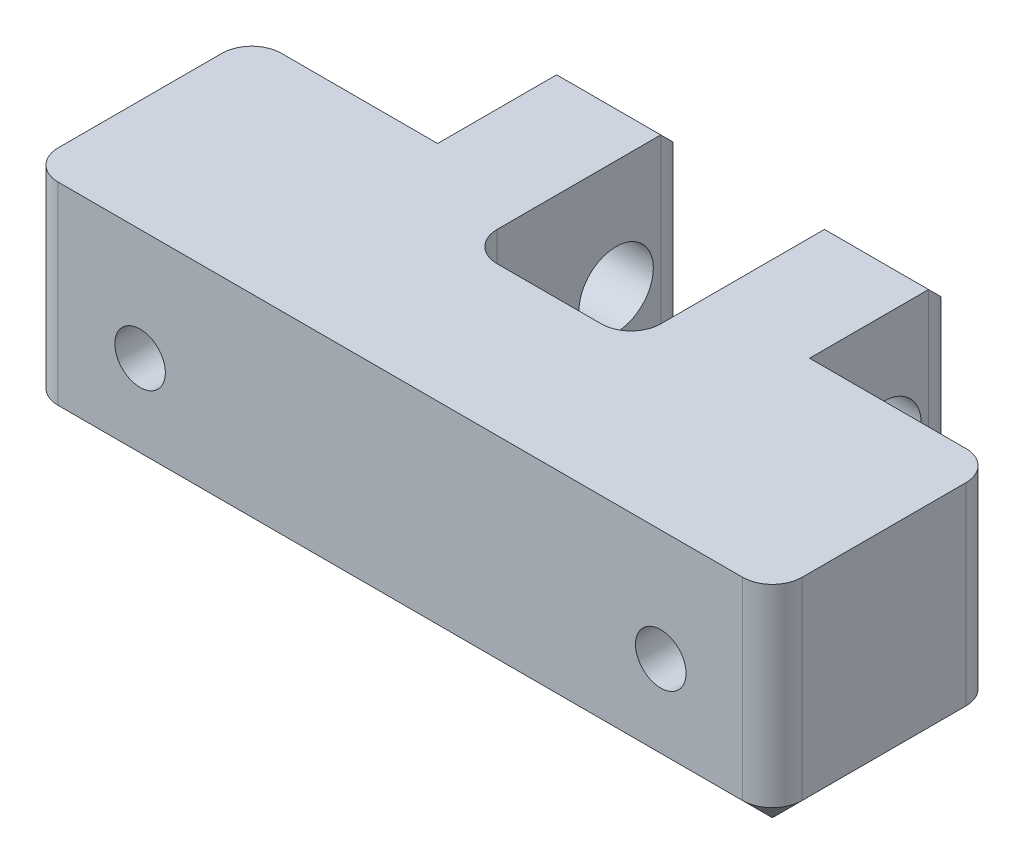
from build123d import *

# Parameters (mm, degrees)
MAIN_BLOCK_DEPTH                = 15
TENSION_SCREW_HOLES_D           = 3.4
TENSION_SCREW_HOLES_CBORE_D     = 6.5
TENSION_SCREW_HOLES_CBORE_DEPTH = 3.4
IDLER_MOUNTING_HOLE_D           = 5
COSMETIC_CHAMFER_SIZE           = 2
PRINT_HELPER_FILLETS_R          = 2
COSMETIC_CHAMFERS_SIZE          = 2


with BuildPart() as part:
    # Main Body Sketch → Main Block (new body)
    with BuildSketch(Plane(origin=(0, 0, 0), x_dir=(1, 0, 0), z_dir=(0, 1, 0))):
        Polygon((-12.5, 20), (-12.5, 10), (-25, 10), (-25, 0), (-25, -5), (25, -5), (25, 10), (12.5, 10), (12.5, 20), (5.5, 20), (5.5, 5), (-5.5, 5), (-5.5, 20), align=None)
    extrude(amount=MAIN_BLOCK_DEPTH)

    # Tension Screw Holes (through all)
    with Locations(Plane(origin=(0, 0, -10), x_dir=(-1, 0, 0), z_dir=(0, 0, -1))):
        with Locations((17.5, 7.5), (-17.5, 7.5)):
            CounterBoreHole(TENSION_SCREW_HOLES_D / 2, TENSION_SCREW_HOLES_CBORE_D / 2, TENSION_SCREW_HOLES_CBORE_DEPTH)

    # Idler Mounting Hole (through all)
    with Locations(Plane(origin=(12.5, 0, 0), x_dir=(0, 0, -1), z_dir=(1, 0, 0))):
        with Locations((15, 7.5)):
            Hole(IDLER_MOUNTING_HOLE_D / 2)

    # Cosmetic Chamfer
    cosmetic_chamfer_edges = [part.edges().sort_by_distance(p)[0] for p in [
        (9, 0, -20),
        (-9, 0, -20),
        (9, 15, -20),
        (-9, 15, -20),
    ]]
    chamfer(cosmetic_chamfer_edges, length=COSMETIC_CHAMFER_SIZE)

    # Print Helper Fillets
    print_helper_fillets_edges = [part.edges().sort_by_distance(p)[0] for p in [
        (-5.5, 7.5, -5),
        (5.5, 7.5, -5),
        (-12.5, 7.5, -20),
        (-5.5, 7.5, -20),
        (5.5, 7.5, -20),
        (12.5, 7.5, -20),
        (-25, 7.5, 5),
        (25, 7.5, -10),
        (25, 7.5, 5),
        (-25, 7.5, -10),
    ]]
    fillet(print_helper_fillets_edges, radius=PRINT_HELPER_FILLETS_R)

    # Cosmetic Chamfers
    cosmetic_chamfers_edges = [part.edges().sort_by_distance(p)[0] for p in [
        (-17.75, 0, -10),
        (-24.414213562, 0, -9.414213562),
        (-25, 0, -2.5),
        (-24.414213562, 0, 4.414213562),
        (0, 0, 5),
        (17.75, 0, -10),
        (24.414213562, 0, 4.414213562),
        (24.414213562, 0, -9.414213562),
        (25, 0, -2.5),
        (-12.5, 0, -14),
        (12.5, 0, -14),
    ]]
    chamfer(cosmetic_chamfers_edges, length=COSMETIC_CHAMFERS_SIZE - 0.0001)  # a hair under: the kernel refuses the full size


solid = part.part
